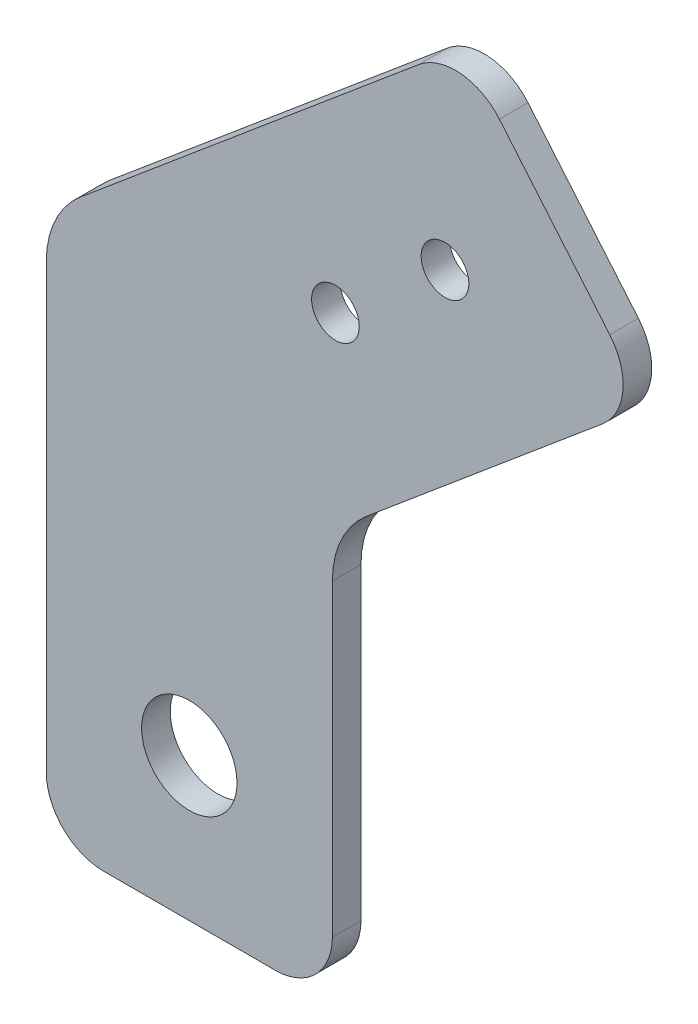
from build123d import *

# Parameters (mm, degrees)
SKETCH1_R          = 5
SKETCH1_R_2        = 2.5
BASE_FLANGE1_DEPTH = 3


# Sheet-metal steps are written as plain solids
with BuildPart() as part:
    # Sketch1 → Base-Flange1 (new body)
    with BuildSketch(Plane.XY):
        with BuildLine():
            Line((-14.238080804, 7.633940989), (-49.730098253, -22.147397762))
            ThreePointArc((-49.730098253, -22.147397762), (-52.365300026, -25.581659576), (-53.302222156, -29.807842194))
            Line((-53.302222156, -29.807842194), (-53.302222156, -48.56164166))
            Line((-53.302222156, -48.56164166), (-53.302222156, -76.139380484))
            ThreePointArc((-53.302222156, -76.139380484), (-51.544862843, -80.382021171), (-47.302222156, -82.139380484))
            Line((-47.302222156, -82.139380484), (-29.302222156, -82.139380484))
            ThreePointArc((-29.302222156, -82.139380484), (-25.059581469, -80.382021171), (-23.302222156, -76.139380484))
            Line((-23.302222156, -76.139380484), (-23.302222156, -48.56164166))
            Line((-23.302222156, -48.56164166), (-23.302222156, -43.797071938))
            ThreePointArc((-23.302222156, -43.797071938), (-22.365300026, -39.570889321), (-19.730098253, -36.136627507))
            Line((-19.730098253, -36.136627507), (5.045547487, -15.347392305))
            ThreePointArc((5.045547487, -15.347392305), (7.165990017, -11.274060103), (5.785088487, -6.894399988))
            Line((5.785088487, -6.894399988), (-5.785088487, 6.894399988))
            ThreePointArc((-5.785088487, 6.894399988), (-9.858420689, 9.014842519), (-14.238080804, 7.633940989))
        make_face()
        with Locations((-38.302222156, -67.139380484)):
            Circle(SKETCH1_R, mode=Mode.SUBTRACT)
        with Locations((-11.490666647, -9.641814145)):
            Circle(SKETCH1_R_2, mode=Mode.SUBTRACT)
        with Locations((-22.981333294, -19.283628291)):
            Circle(SKETCH1_R_2, mode=Mode.SUBTRACT)
    extrude(amount=-BASE_FLANGE1_DEPTH)


solid = part.part
